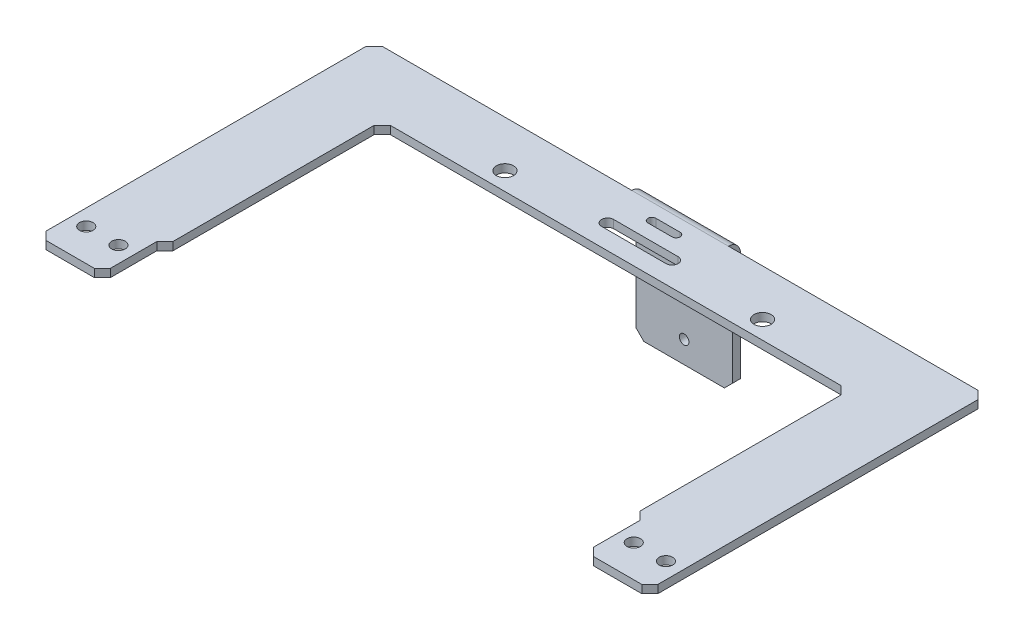
from build123d import *

# Parameters (mm, degrees)
SKETCH1_R          = 2.667
SKETCH1_R_2        = 3.3782
BASE_FLANGE1_DEPTH = 3.175
CHAMFER2_SIZE      = 3.175
EDGE_FLANGE1_DEPTH = 38.1
CHAMFER3_SIZE      = 3.175
SKETCH9_R          = 1.905
CUT_EXTRUDE1_DEPTH = 282.707277995
CUT_EXTRUDE2_DEPTH = 283.261385688
CUT_EXTRUDE3_DEPTH = 283.261385688


# Sheet-metal steps are written as plain solids
with BuildPart() as part:
    # Sketch1 → Base-Flange1 (new body)
    with BuildSketch(Plane(origin=(0, 0, 0), x_dir=(1, 0, 0), z_dir=(0, 1, 0))):
        Polygon((25.4, 0), (0, 0), (0, 132.588), (241.3, 132.588), (241.3, 0), (215.9, 0), (215.9, 21.463), (212.725, 24.638), (212.725, 107.188), (28.575, 107.188), (28.575, 24.638), (25.4, 21.463), align=None)
        with Locations(Location((6.35, 12.7, 0), (0, 0, 270))):
            Circle(SKETCH1_R, mode=Mode.SUBTRACT)
        with Locations(Location((19.05, 12.7, 0), (0, 0, 270))):
            Circle(SKETCH1_R, mode=Mode.SUBTRACT)
        with Locations(Location((222.25, 12.7, 0), (0, 0, 90))):
            Circle(SKETCH1_R, mode=Mode.SUBTRACT)
        with Locations(Location((234.95, 12.7, 0), (0, 0, 90))):
            Circle(SKETCH1_R, mode=Mode.SUBTRACT)
        with Locations(Location((69.85, 114.3, 0), (0, 0, 270))):
            Circle(SKETCH1_R_2, mode=Mode.SUBTRACT)
        with Locations(Location((171.45, 114.3, 0), (0, 0, 90))):
            Circle(SKETCH1_R_2, mode=Mode.SUBTRACT)
    extrude(amount=BASE_FLANGE1_DEPTH)

    # Chamfer2
    chamfer2_edges = [part.edges().sort_by_distance(p)[0] for p in [
        (0, 1.5875, -132.588),
        (241.3, 1.5875, -132.588),
        (241.3, 1.5875, 0),
        (215.9, 1.5875, 0),
        (212.725, 1.5875, -107.188),
        (28.575, 1.5875, -107.188),
        (25.4, 1.5875, 0),
        (0, 1.5875, 0),
    ]]
    chamfer(chamfer2_edges, length=CHAMFER2_SIZE)

    # Edge-Flange1 section (across the edge) → Edge-Flange1 (add)
    with BuildSketch(Plane(origin=(101.6, 0, -134.1755), x_dir=(0, 0, 1), z_dir=(1, 0, 0))):
        with BuildLine():
            Line((-3.175, 1.5875), (-3.175, 47.625))
            Line((-3.175, 47.625), (0, 47.625))
            Line((0, 47.625), (0, 1.5875))
            ThreePointArc((0, 1.5875), (0.464967985, 0.464967985), (1.5875, 0))
            Line((1.5875, 0), (1.5875, -3.175))
            ThreePointArc((1.5875, -3.175), (-1.780096045, -1.780096045), (-3.175, 1.5875))
        make_face()
    extrude(amount=EDGE_FLANGE1_DEPTH)

    # Chamfer3
    chamfer3_edges = [part.edges().sort_by_distance(p)[0] for p in [
        (101.6, -47.625, -135.763),
        (139.7, -47.625, -135.763),
    ]]
    chamfer(chamfer3_edges, length=CHAMFER3_SIZE)

    # Sketch9 → Cut-Extrude1 (cut, through all)
    with BuildSketch(Plane(origin=(0, 0, -137.3505), x_dir=(-1, 0, 0), z_dir=(0, 0, -1))):
        with Locations(Location((-120.65, -38.989, 0), (0, 0, 90))):
            Circle(SKETCH9_R)
        with Locations(Location((-120.65, -19.939, 0), (0, 0, 90))):
            Circle(SKETCH9_R)
    extrude(amount=-CUT_EXTRUDE1_DEPTH, mode=Mode.SUBTRACT)

    # Sketch10 → Cut-Extrude2 (cut, through all)
    with BuildSketch(Plane(origin=(0, 3.175, 0), x_dir=(1, 0, 0), z_dir=(0, 1, 0))):
        with BuildLine():
            Line((115.8875, 127.8255), (125.4125, 127.8255))
            ThreePointArc((125.4125, 127.8255), (127, 126.238), (125.4125, 124.6505))
            Line((125.4125, 124.6505), (115.8875, 124.6505))
            ThreePointArc((115.8875, 124.6505), (114.3, 126.238), (115.8875, 127.8255))
        make_face()
    extrude(amount=-CUT_EXTRUDE2_DEPTH, mode=Mode.SUBTRACT)

    # Sketch11 → Cut-Extrude3 (cut, through all)
    with BuildSketch(Plane(origin=(0, 3.175, 0), x_dir=(1, 0, 0), z_dir=(0, 1, 0))):
        with BuildLine():
            Line((107.95, 119.09425), (133.35, 119.09425))
            ThreePointArc((133.35, 119.09425), (135.73125, 116.713), (133.35, 114.33175))
            Line((133.35, 114.33175), (107.95, 114.33175))
            ThreePointArc((107.95, 114.33175), (105.56875, 116.713), (107.95, 119.09425))
        make_face()
    extrude(amount=-CUT_EXTRUDE3_DEPTH, mode=Mode.SUBTRACT)


solid = part.part
